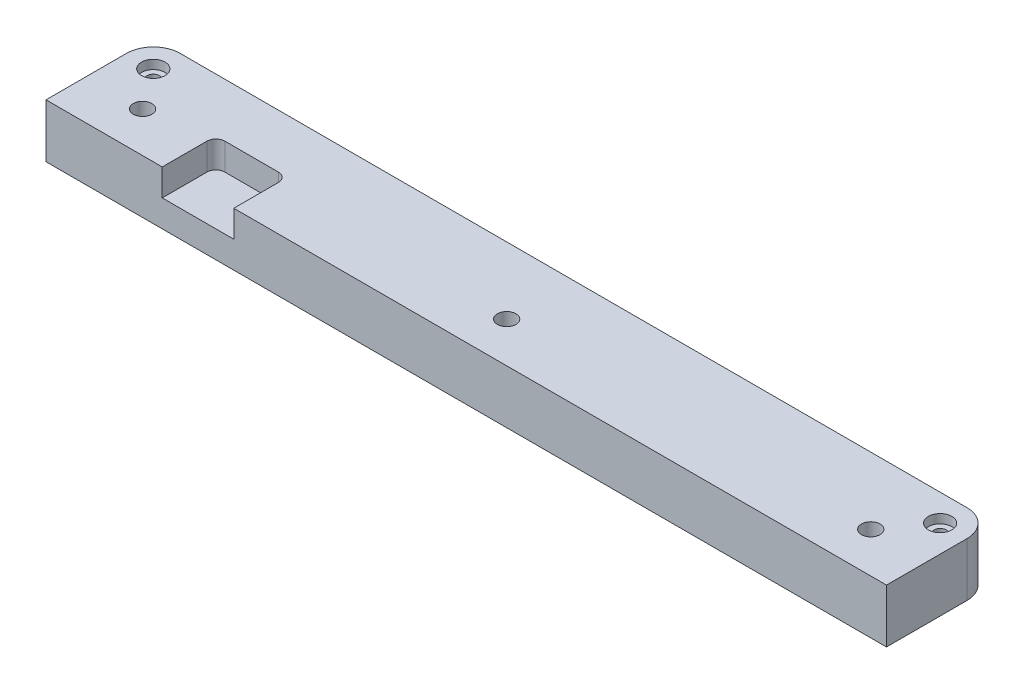
from build123d import *

# Parameters (mm, degrees)
SKETCH1_W           = 298.45
SKETCH1_H           = 38.1
BOSS_EXTRUDE1_DEPTH = 19.05
FILLET1_R           = 9.525
SKETCH2_R           = 3.302
CUT_EXTRUDE1_DEPTH  = 14.2875
SKETCH4_R           = 1.6256
CUT_EXTRUDE2_DEPTH  = 302.47456775
SKETCH5_R           = 2.667
CUT_EXTRUDE3_DEPTH  = 2.921
SKETCH6_R           = 2.1844
CUT_EXTRUDE4_DEPTH  = 302.47456775
CUT_EXTRUDE5_START  = -6.35
CUT_EXTRUDE5_DEPTH  = 296.12456775
CUT_EXTRUDE6_START  = -9.525
SKETCH8_W           = 25.4
SKETCH8_H           = 19.05
CUT_EXTRUDE6_DEPTH  = 9.525
FILLET2_R           = 3.175
FILLET3_R           = 1.5875
SKETCH11_R          = 4.16687
CUT_EXTRUDE7_DEPTH  = 3.175


with BuildPart() as part:
    # Sketch1 → Boss-Extrude1 (new body)
    with BuildSketch(Plane(origin=(0, 0, 0), x_dir=(1, 0, 0), z_dir=(0, 1, 0))):
        with Locations((149.225, 19.05)):
            Rectangle(SKETCH1_W, SKETCH1_H)
    extrude(amount=BOSS_EXTRUDE1_DEPTH)

    # Fillet1
    fillet1_edges = [part.edges().sort_by_distance(p)[0] for p in [
        (298.45, 9.525, -38.1),
        (0, 9.525, -38.1),
    ]]
    fillet(fillet1_edges, radius=FILLET1_R)

    # Sketch2 → Cut-Extrude1 (cut)
    with BuildSketch(Plane(origin=(0, 19.05, 0), x_dir=(1, 0, 0), z_dir=(0, 1, 0))):
        with Locations((19.939, 14.351)):
            Circle(SKETCH2_R)
        with Locations((149.225, 14.351)):
            Circle(SKETCH2_R)
        with Locations((278.511, 14.351)):
            Circle(SKETCH2_R)
    extrude(amount=-CUT_EXTRUDE1_DEPTH, mode=Mode.SUBTRACT)

    # Sketch4 → Cut-Extrude2 (cut, through all)
    with BuildSketch(Plane.XZ):
        with Locations((19.939, -14.351)):
            Circle(SKETCH4_R)
        with Locations((149.225, -14.351)):
            Circle(SKETCH4_R)
        with Locations((278.511, -14.351)):
            Circle(SKETCH4_R)
    extrude(amount=-CUT_EXTRUDE2_DEPTH, mode=Mode.SUBTRACT)

    # Sketch5 → Cut-Extrude3 (cut)
    with BuildSketch(Plane.XZ):
        with Locations((19.939, -14.351)):
            Circle(SKETCH5_R)
        with Locations((149.225, -14.351)):
            Circle(SKETCH5_R)
        with Locations((278.511, -14.351)):
            Circle(SKETCH5_R)
    extrude(amount=-CUT_EXTRUDE3_DEPTH, mode=Mode.SUBTRACT)

    # Sketch6 → Cut-Extrude4 (cut, through all)
    with BuildSketch(Plane(origin=(0, 19.05, 0), x_dir=(1, 0, 0), z_dir=(0, 1, 0))):
        with Locations((288.925, 28.575)):
            Circle(SKETCH6_R)
        with Locations((9.525, 28.575)):
            Circle(SKETCH6_R)
    extrude(amount=-CUT_EXTRUDE4_DEPTH, mode=Mode.SUBTRACT)

    # Sketch7 → Cut-Extrude5 (cut, through all)
    with BuildSketch(Plane(origin=(0, 19.05, 0), x_dir=(1, 0, 0), z_dir=(0, 1, 0)).offset(CUT_EXTRUDE5_START)):
        Polygon((140.389520155, 28.575), (144.807260078, 20.92325), (153.642739922, 20.92325), (158.060479845, 28.575), (153.642739922, 36.22675), (144.807260078, 36.22675), align=None)
    extrude(amount=-CUT_EXTRUDE5_DEPTH, mode=Mode.SUBTRACT)

    # Sketch8 → Cut-Extrude6 (cut)
    with BuildSketch(Plane.XZ.offset(CUT_EXTRUDE6_START)):
        with Locations((53.975, -9.525)):
            Rectangle(SKETCH8_W, SKETCH8_H)
    extrude(amount=-CUT_EXTRUDE6_DEPTH, mode=Mode.SUBTRACT)

    # Fillet2
    fillet2_edges = [part.edges().sort_by_distance(p)[0] for p in [
        (66.675, 14.2875, -19.05),
        (41.275, 14.2875, -19.05),
    ]]
    fillet(fillet2_edges, radius=FILLET2_R)

    # Fillet3
    fillet3_edges = [part.edges().sort_by_distance(p)[0] for p in [
        (144.807260078, 6.35, -36.22675),
        (140.389520155, 6.35, -28.575),
        (144.807260078, 6.35, -20.92325),
        (153.642739922, 6.35, -20.92325),
        (158.060479845, 6.35, -28.575),
        (153.642739922, 6.35, -36.22675),
    ]]
    fillet(fillet3_edges, radius=FILLET3_R)

    # Sketch11 → Cut-Extrude7 (cut)
    with BuildSketch(Plane(origin=(0, 19.05, 0), x_dir=(1, 0, 0), z_dir=(0, 1, 0))):
        with Locations((9.525, 28.575)):
            Circle(SKETCH11_R)
        with Locations((288.925, 28.575)):
            Circle(SKETCH11_R)
    extrude(amount=-CUT_EXTRUDE7_DEPTH, mode=Mode.SUBTRACT)


solid = part.part
